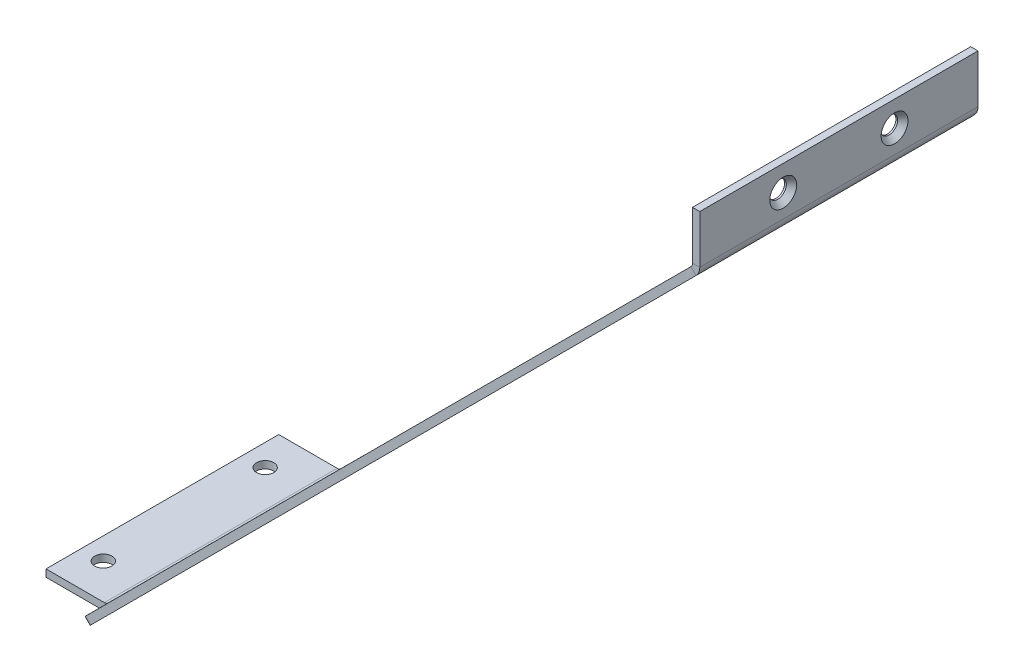
from build123d import *

# Parameters (mm, degrees)
BASE_FLANGE1_DEPTH                            = 43.6626
SKETCH3_W                                     = 39.3553177
SKETCH3_H                                     = 59.329005091
CUT_EXTRUDE1_DEPTH                            = 221.446361168
CSK_FOR_8_FLAT_HEAD_MACHINE_SCREW1_AT_2_COUNT = 2
CSK_FOR_8_FLAT_HEAD_MACHINE_SCREW1_AT_2_PITCH = 34.9504
SKETCH6_R                                     = 3.175
SKETCH6_R_2                                   = 2.0193
SKETCH6_R_3                                   = 2.7051
CUT_EXTRUDE2_DEPTH                            = 7.62
CUT_EXTRUDE3_REACH                            = 258.55
SKETCH7_R                                     = 2.7051
CE_00_NOTCH_FOR_WIRE_REACH                    = 222.446


# Sheet-metal steps are written as plain solids
with BuildPart() as part:
    # Sketch1 → Base-Flange1 (new, symmetric)
    with BuildSketch(Plane.XY):
        with BuildLine():
            Line((139.7, -25.4), (139.7, -40.559570335))
            ThreePointArc((139.7, -40.559570335), (139.568524729, -41.220541159), (139.194114832, -41.780885168))
            Line((139.194114832, -41.780885168), (-50.802114832, -231.777114832))
            ThreePointArc((-50.802114832, -231.777114832), (-51.362458841, -232.151524729), (-52.023429665, -232.283))
            Line((-52.023429665, -232.283), (-70.358, -232.283))
            Line((-70.358, -232.283), (-70.358, -234.569))
            Line((-70.358, -234.569), (-52.023429665, -234.569))
            ThreePointArc((-52.023429665, -234.569), (-50.487644514, -234.26351334), (-49.185668731, -233.393560934))
            Line((-49.185668731, -233.393560934), (140.810560934, -43.397331269))
            ThreePointArc((140.810560934, -43.397331269), (141.68051334, -42.095355486), (141.986, -40.559570335))
            Line((141.986, -40.559570335), (141.986, -25.4))
            Line((141.986, -25.4), (139.7, -25.4))
        make_face()
    extrude(amount=BASE_FLANGE1_DEPTH, both=True)

    # Sketch3 → Cut-Extrude1 (cut, through all)
    with BuildSketch(Plane(origin=(92.103946102, -92.103946102, 0), x_dir=(0, 0, -1), z_dir=(0.7071067811865464, -0.7071067811865487, 0))):
        with Locations((-56.20285885, -229.689502546)):
            Rectangle(SKETCH3_W, SKETCH3_H)
        with Locations((56.20285885, -229.689502546)):
            Rectangle(SKETCH3_W, SKETCH3_H)
    extrude(amount=-CUT_EXTRUDE1_DEPTH, mode=Mode.SUBTRACT)

    # Sketch4 → CSK for #8 Flat Head Machine Screw1 (revolve, cut)
    with BuildSketch(Plane(origin=(141.986, -33.3502, -17.4752), x_dir=(0, 0, -1), z_dir=(0, 1, 0))):
        Polygon((0, 0), (0, 2.286), (2.7051, 2.286), (2.7051, 1.738551774), (4.2164, 0), align=None)
    csk_for_8_flat_head_machine_screw1 = revolve(axis=Axis((148.336, -33.3502, -17.4752), (-1, 0, 0)), mode=Mode.SUBTRACT)

    # CSK for #8 Flat Head Machine Screw1 at 2: CSK for #8 Flat Head Machine Screw1 ×2
    with Locations(*[(0, 0, i * CSK_FOR_8_FLAT_HEAD_MACHINE_SCREW1_AT_2_PITCH) for i in range(1, CSK_FOR_8_FLAT_HEAD_MACHINE_SCREW1_AT_2_COUNT)]):
        add(csk_for_8_flat_head_machine_screw1, mode=Mode.SUBTRACT)

    # Sketch6 → Cut-Extrude2 (cut)
    with BuildSketch(Plane(origin=(92.103946102, -92.103946102, 0), x_dir=(0, 0, -1), z_dir=(0.7071067811865465, -0.7071067811865486, 0))):
        with Locations(Location((0, 56.896984938, 0), (0, 0, 90))):
            Circle(SKETCH6_R)
        with Locations(Location((25.4, 44.196984938, 0), (0, 0, 90))):
            Circle(SKETCH6_R_2)
        with Locations(Location((25.4, -32.003015062, 0), (0, 0, 90))):
            Circle(SKETCH6_R_2)
        with Locations(Location((25.4, -108.203015062, 0), (0, 0, 90))):
            Circle(SKETCH6_R_2)
        with Locations(Location((-25.4, -108.203015062, 0), (0, 0, 90))):
            Circle(SKETCH6_R_2)
        with Locations(Location((-25.4, -32.003015062, 0), (0, 0, 90))):
            Circle(SKETCH6_R_2)
        with Locations(Location((-25.4, 44.196984938, 0), (0, 0, 90))):
            Circle(SKETCH6_R_2)
        with Locations(Location((0, -32.003015062, 0), (0, 0, 90))):
            Circle(SKETCH6_R_3)
        with Locations(Location((25.4, -184.403015062, 0), (0, 0, 90))):
            Circle(SKETCH6_R_2)
        with Locations(Location((-25.4, -184.403015062, 0), (0, 0, 90))):
            Circle(SKETCH6_R_2)
        with Locations(Location((0, -83.518444727, 0), (0, 0, 90))):
            Circle(SKETCH6_R_3)
    extrude(amount=-CUT_EXTRUDE2_DEPTH, mode=Mode.SUBTRACT)

    # Sketch7 → Cut-Extrude3 (cut, up to next)
    with BuildSketch(Plane.XZ.offset(234.569), mode=Mode.PRIVATE) as cut_extrude3_sk1:
        with Locations((-63.5, 25.4)):
            Circle(SKETCH7_R)
    cut_extrude3_tool1 = extrude(cut_extrude3_sk1.sketch, amount=-CUT_EXTRUDE3_REACH, mode=Mode.PRIVATE) & part.part
    # Sketch7 → Cut-Extrude3 (cut, up to next)
    with BuildSketch(Plane.XZ.offset(234.569), mode=Mode.PRIVATE) as cut_extrude3_sk2:
        with Locations((-63.5, -25.4)):
            Circle(SKETCH7_R)
    cut_extrude3_tool2 = extrude(cut_extrude3_sk2.sketch, amount=-CUT_EXTRUDE3_REACH, mode=Mode.PRIVATE) & part.part
    add(cut_extrude3_tool1.solids().sort_by_distance((-63.5, -234.569, 25.4))[0], mode=Mode.SUBTRACT)
    add(cut_extrude3_tool2.solids().sort_by_distance((-63.5, -234.569, -25.4))[0], mode=Mode.SUBTRACT)

    # Sketch8 → CE-00 Notch for Wire (cut, up to next)
    with BuildSketch(Plane(origin=(92.103946102, -92.103946102, 0), x_dir=(0, 0, -1), z_dir=(0.7071067811865465, -0.7071067811865486, 0)), mode=Mode.PRIVATE) as ce_00_notch_for_wire_sk1:
        with BuildLine():
            Line((64.632412862, -80.216444727), (35.7124, -80.216444727))
            ThreePointArc((35.7124, -80.216444727), (32.4104, -83.518444727), (35.7124, -86.820444727))
            Line((35.7124, -86.820444727), (64.632412862, -86.820444727))
            Line((64.632412862, -86.820444727), (64.632412862, -80.216444727))
        make_face()
    ce_00_notch_for_wire_tool1 = extrude(ce_00_notch_for_wire_sk1.sketch, amount=-CE_00_NOTCH_FOR_WIRE_REACH, mode=Mode.PRIVATE) & part.part
    add(ce_00_notch_for_wire_tool1.solids().sort_by_distance((33.047487, -151.160405, -48.867096))[0], mode=Mode.SUBTRACT)


solid = part.part
